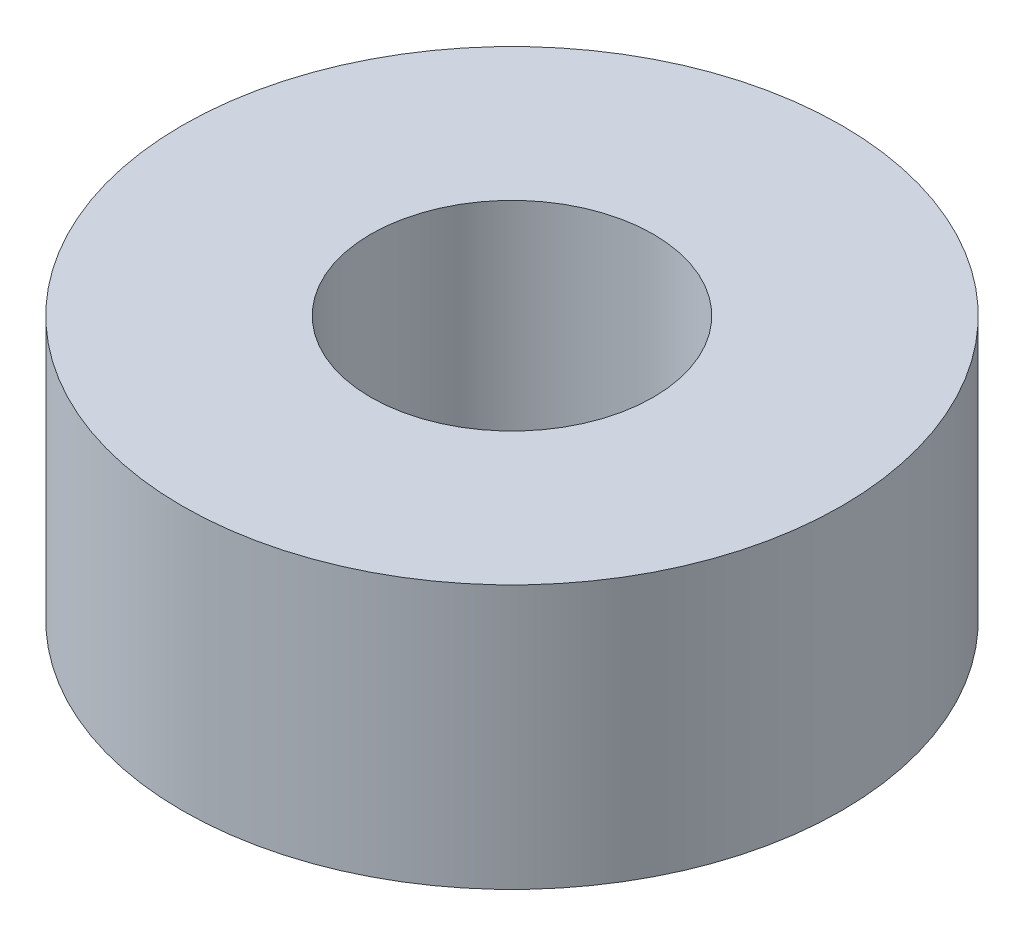
from build123d import *

# Parameters (mm, degrees)
SKETCH1_R           = 17.5
BOSS_EXTRUDE1_DEPTH = 14
SKETCH2_R           = 7.5
CUT_EXTRUDE1_DEPTH  = 29.434134416


with BuildPart() as part:
    # Sketch1 → Boss-Extrude1 (new body)
    with BuildSketch(Plane(origin=(0, 0, 0), x_dir=(1, 0, 0), z_dir=(0, 1, 0))):
        Circle(SKETCH1_R)
    extrude(amount=BOSS_EXTRUDE1_DEPTH)

    # Sketch2 → Cut-Extrude1 (cut, through all)
    with BuildSketch(Plane(origin=(0, 0, 0), x_dir=(1, 0, 0), z_dir=(0, 1, 0))):
        Circle(SKETCH2_R)
    extrude(amount=CUT_EXTRUDE1_DEPTH, mode=Mode.SUBTRACT)


solid = part.part
